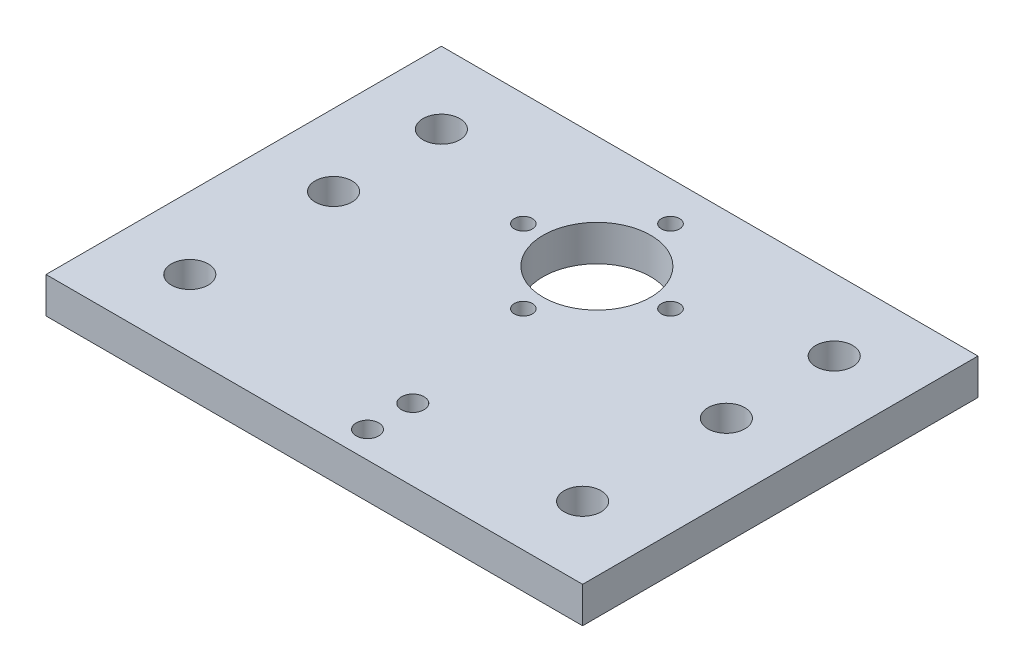
from build123d import *

# Parameters (mm, degrees)
SKETCH1_W                                       = 94.8
SKETCH1_H                                       = 69.85
SKETCH1_R                                       = 3.25755
SKETCH1_R_2                                     = 2
SKETCH1_R_3                                     = 9.5
BOSS_EXTRUDE1_DEPTH                             = 6.35
CSK_FOR_M3_FLAT_HEAD_MACHINE_SCREW1_D           = 3.2
CSK_FOR_M3_FLAT_HEAD_MACHINE_SCREW1_CSINK_D     = 6.3
CSK_FOR_M3_FLAT_HEAD_MACHINE_SCREW1_CSINK_ANGLE = 90


with BuildPart() as part:
    # Sketch1 → Boss-Extrude1 (new body)
    with BuildSketch(Plane(origin=(0, 0, 0), x_dir=(1, 0, 0), z_dir=(0, 1, 0))):
        Rectangle(SKETCH1_W, SKETCH1_H)
        with Locations((-34.7, 22.225)):
            Circle(SKETCH1_R, mode=Mode.SUBTRACT)
        with Locations((34.7, 22.225)):
            Circle(SKETCH1_R, mode=Mode.SUBTRACT)
        with Locations((34.7, -22.225)):
            Circle(SKETCH1_R, mode=Mode.SUBTRACT)
        with Locations((-34.7, -22.225)):
            Circle(SKETCH1_R, mode=Mode.SUBTRACT)
        with Locations((4.7, -30.225)):
            Circle(SKETCH1_R_2, mode=Mode.SUBTRACT)
        with Locations((4.7, -22.225)):
            Circle(SKETCH1_R_2, mode=Mode.SUBTRACT)
        with Locations((0, 15)):
            Circle(SKETCH1_R_3, mode=Mode.SUBTRACT)
        with Locations((-34.7, 3.175)):
            Circle(SKETCH1_R, mode=Mode.SUBTRACT)
        with Locations((34.7, 3.175)):
            Circle(SKETCH1_R, mode=Mode.SUBTRACT)
    extrude(amount=BOSS_EXTRUDE1_DEPTH)

    # CSK for M3 Flat Head Machine Screw1 (through all)
    with Locations(Plane(origin=(0, 0, 0), x_dir=(-1, 0, 0), z_dir=(0, -1, 0))):
        with Locations((-13, 15), (0, 2), (13, 15), (0, 28)):
            CounterSinkHole(CSK_FOR_M3_FLAT_HEAD_MACHINE_SCREW1_D / 2, CSK_FOR_M3_FLAT_HEAD_MACHINE_SCREW1_CSINK_D / 2, counter_sink_angle=CSK_FOR_M3_FLAT_HEAD_MACHINE_SCREW1_CSINK_ANGLE)


solid = part.part
